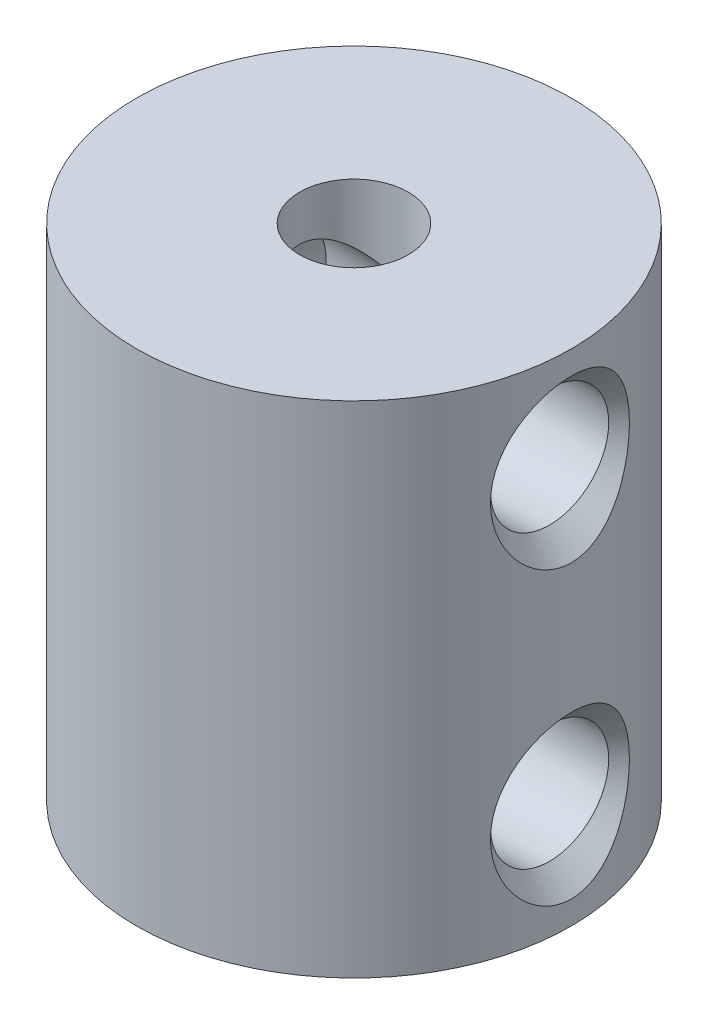
from build123d import *

# Parameters (mm, degrees)
SKETCH1_R             = 6.35
BOSS_EXTRUDE1_DEPTH   = 14.605
SKETCH2_R             = 1.5875
CUT_EXTRUDE1_DEPTH    = 18.145
BODY_MOVE_COPY3_ANGLE = 0.1216002


with BuildPart() as part:
    # Sketch1 → Boss-Extrude1 (new body)
    with BuildSketch(Plane(origin=(0, 0, 0), x_dir=(1, 0, 0), z_dir=(0, 1, 0))):
        with Locations(Location((0, 0, 0), (0, 0, 90))):
            Circle(SKETCH1_R)
    extrude(amount=BOSS_EXTRUDE1_DEPTH)

    # Sketch2 → Cut-Extrude1 (cut, through all)
    with BuildSketch(Plane(origin=(0, 0, 0), x_dir=(-1, 0, 0), z_dir=(0, -1, 0))):
        with Locations(Location((0, 0, 0), (0, 0, 90))):
            Circle(SKETCH2_R)
    extrude(amount=-CUT_EXTRUDE1_DEPTH, mode=Mode.SUBTRACT)

    # Sketch16 → #8-32 Tapped Hole3 (revolve, cut)
    with BuildSketch(Plane(origin=(6.349985699, 3.048, -0.013476749), x_dir=(-0.002122322633644313, 0, -0.9999977478707834), z_dir=(0, 1, 0))):
        Polygon((0, 0), (0, 9.927806461), (1.7272, 8.89), (1.7272, 0.635), (2.3622, 0), align=None)
    f_8_32_tapped_hole3 = revolve(axis=Axis((12.699971398, 3.048, -0.026953497), (-0.9999977478707834, 0, 0.002122322633644313)), mode=Mode.SUBTRACT)

    # Mirror2: #8-32 Tapped Hole3 across plane
    add(f_8_32_tapped_hole3.mirror(Plane.ZX.offset(7.3025)), mode=Mode.SUBTRACT)


with BuildPart() as part_1:
    # Body-Move/Copy3: read off the stored shape, not the designer's step
    # Body-Move/Copy3: moved
    add(part.part.moved(Location((-5.7150129, 0, 0))).rotate(Axis((0, 0, 0), (0, -1, 0)), BODY_MOVE_COPY3_ANGLE))


solid = part_1.part
